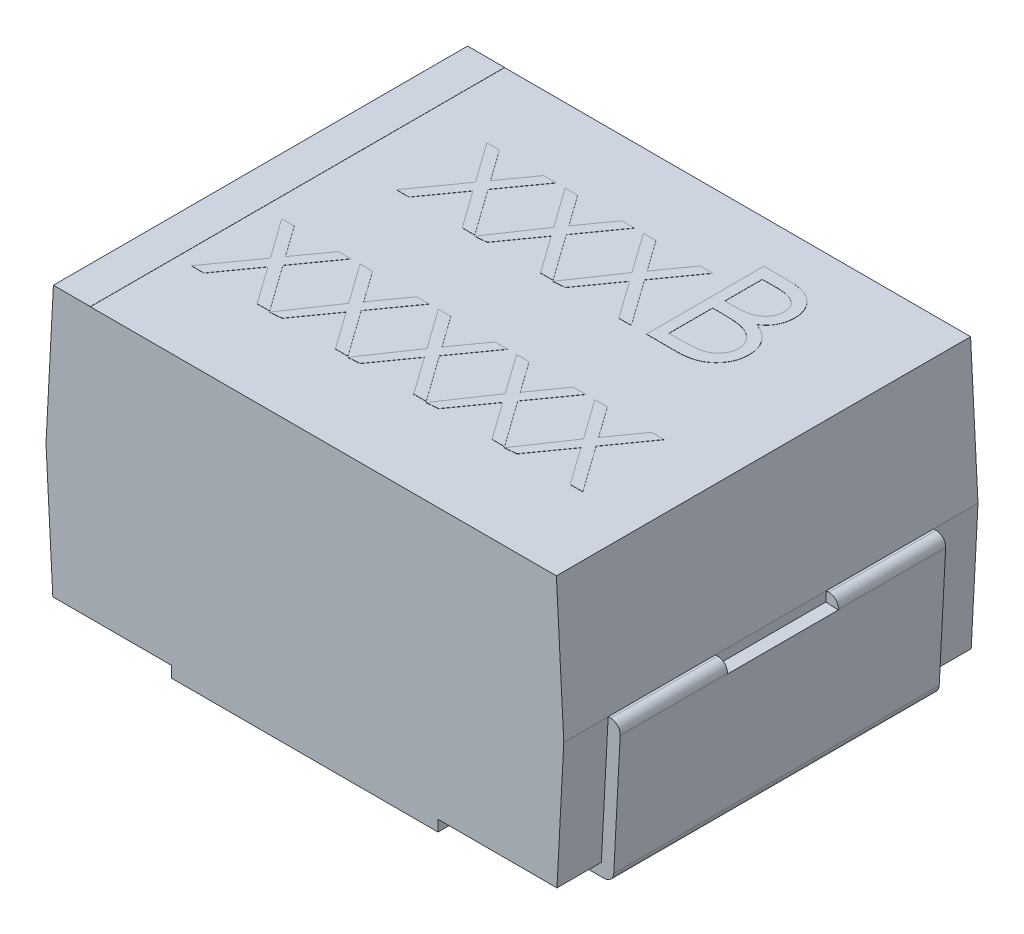
from build123d import *

# Parameters (mm, degrees)
BOSS_EXTRUDE1_DEPTH = 1.4
CUT_EXTRUDE1_REACH  = 5.436
BOSS_EXTRUDE2_DEPTH = 1.1
CUT_EXTRUDE2_REACH  = 5.98
SKETCH4_W           = 1.3
SKETCH4_H           = 1.2
SKETCH5_W           = 0.25
SKETCH5_H           = 2.8
BOSS_EXTRUDE3_DEPTH = 0.00125
BOSS_EXTRUDE4_DEPTH = 0.00125
BOSS_EXTRUDE5_DEPTH = 0.00125
CUT_EXTRUDE3_REACH  = 5.98
SKETCH8_W           = 0.75
SKETCH8_H           = 0.135


# Read off the part's stored shape, not the designer's step: Boss-Extrude4, Boss-Extrude5
with BuildPart() as part:
    # Sketch1 → Boss-Extrude1 (new, symmetric)
    with BuildSketch(Plane.XY):
        Polygon((-1.7, 0.95), (1.7, 0.95), (1.75, 0), (1.7, -0.95), (-1.7, -0.95), (-1.75, 0), align=None)
    extrude(amount=BOSS_EXTRUDE1_DEPTH, both=True)

    # Sketch2 → Cut-Extrude1 (cut, up to next)
    with BuildSketch(Plane.XY.offset(1.4), mode=Mode.PRIVATE) as cut_extrude1_sk1:
        Polygon((-1.7, -0.95), (-0.9, -0.95), (-0.9, -0.875), (-1.703947368, -0.875), align=None)
    cut_extrude1_tool1 = extrude(cut_extrude1_sk1.sketch, amount=-CUT_EXTRUDE1_REACH, mode=Mode.PRIVATE) & part.part
    # Sketch2 → Cut-Extrude1 (cut, up to next)
    with BuildSketch(Plane.XY.offset(1.4), mode=Mode.PRIVATE) as cut_extrude1_sk2:
        Polygon((1.7, -0.95), (0.9, -0.95), (0.9, -0.875), (1.703947368, -0.875), align=None)
    cut_extrude1_tool2 = extrude(cut_extrude1_sk2.sketch, amount=-CUT_EXTRUDE1_REACH, mode=Mode.PRIVATE) & part.part
    add(cut_extrude1_tool1.solids().sort_by_distance((-1.300988, -0.912469, 1.4))[0], mode=Mode.SUBTRACT)
    add(cut_extrude1_tool2.solids().sort_by_distance((1.300988, -0.912469, 1.4))[0], mode=Mode.SUBTRACT)

    # Sketch5 → Boss-Extrude3 (add)
    with BuildSketch(Plane(origin=(0, 0.95, 0), x_dir=(1, 0, 0), z_dir=(0, 1, 0))):
        with Locations((-1.575, 0)):
            Rectangle(SKETCH5_W, SKETCH5_H)
    extrude(amount=BOSS_EXTRUDE3_DEPTH)


with BuildPart() as body_2:
    # Sketch3 → Boss-Extrude2 (new, symmetric)
    with BuildSketch(Plane.XY):
        with BuildLine():
            Line((-1.75, 0), (-1.703947368, -0.875))
            Line((-1.703947368, -0.875), (-0.94, -0.875))
            Line((-0.94, -0.875), (-0.94, -0.895))
            ThreePointArc((-0.94, -0.895), (-0.959038059, -0.940961941), (-1.005, -0.96))
            Line((-1.005, -0.96), (-1.722804771, -0.96))
            ThreePointArc((-1.722804771, -0.96), (-1.767542557, -0.942154327), (-1.78771493, -0.898416324))
            Line((-1.78771493, -0.898416324), (-1.831399141, -0.068416324))
            ThreePointArc((-1.831399141, -0.068416324), (-1.813643309, -0.020262214), (-1.766488982, 0))
            Line((-1.766488982, 0), (-1.75, 0))
        make_face()
    extrude(amount=BOSS_EXTRUDE2_DEPTH, both=True)


with BuildPart() as body_3:
    # Mirror1: mirrored copy
    add(body_2.part.mirror(Plane(origin=(0, 0, 0), x_dir=(0, 0, 1), z_dir=(1, 0, 0))))

    # Cut-Extrude3: up to this face of the body (flat: up to its plane)
    cut_extrude3_end = Plane(body_3.part.faces().sort_by_distance((1.809557036, -0.483416324, 0))[0])
    # Sketch8 → Cut-Extrude3 (cut, up to the picked face)
    with BuildSketch(Plane(origin=(1.745165746, -0.091850829, 0), x_dir=(0, 0, -1), z_dir=(0.9986178293325098, -0.052558833122763125, 0)), mode=Mode.PRIVATE) as cut_extrude3_sk1:
        with Locations((0, 0.091977958)):
            Rectangle(SKETCH8_W, SKETCH8_H)
    cut_extrude3_tool1 = split(extrude(cut_extrude3_sk1.sketch, amount=CUT_EXTRUDE3_REACH, mode=Mode.PRIVATE), bisect_by=cut_extrude3_end, keep=Keep.BOTH, mode=Mode.PRIVATE)
    add(cut_extrude3_tool1.solids().sort_by(Axis((1.75, 0, 0), (0.9986178293325098, -0.052558833122763125, 0)))[0], mode=Mode.SUBTRACT)


with BuildPart() as body_2_1:
    add(body_2.part)

    # Cut-Extrude2: up to this face of the body (flat: up to its plane)
    cut_extrude2_end = Plane(body_2_1.part.faces().sort_by_distance((-1.809557036, -0.483416324, 0))[0])
    # Sketch4 → Cut-Extrude2 (cut, up to the picked face)
    with BuildSketch(Plane(origin=(-1.745165746, -0.091850829, 0), x_dir=(0, 0, 1), z_dir=(-0.9986178293325095, -0.052558833122767205, 0)), mode=Mode.PRIVATE) as cut_extrude2_sk1:
        with Locations((0, 0.091977958)):
            Rectangle(SKETCH4_W, SKETCH4_H)
    cut_extrude2_tool1 = split(extrude(cut_extrude2_sk1.sketch, amount=CUT_EXTRUDE2_REACH, mode=Mode.PRIVATE), bisect_by=cut_extrude2_end, keep=Keep.BOTH, mode=Mode.PRIVATE)
    add(cut_extrude2_tool1.solids().sort_by(Axis((-1.75, 0, 0), (-0.9986178293325095, -0.052558833122767205, 0)))[0], mode=Mode.SUBTRACT)


with BuildPart() as body_4:
    # Boss-Extrude4 outline → Boss-Extrude4 (new body)
    # profile 1 of 4: a face of its own
    with BuildSketch(Plane(origin=(0, 0.95, 0), x_dir=(1, 0, 0), z_dir=(0, 1, 0))):
        with BuildLine():
            add(Edge.make_bspline(
                [(1.058270111, 0.543776871), (1.058048576, 0.536028312), (1.0576127, 0.520782806), (1.054396885, 0.498386552), (1.048951963, 0.476983663), (1.041451899, 0.456435702), (1.031663303, 0.436782421), (1.019750711, 0.418001556), (1.005546767, 0.400281806), (0.989657509, 0.38342627), (0.971681987, 0.368270682), (0.952288236, 0.35477337), (0.931232017, 0.343673103), (0.908859154, 0.334348576), (0.884918675, 0.327225873), (0.859518084, 0.322242807), (0.832679287, 0.318885236), (0.814262075, 0.318609191), (0.804817086, 0.318467626)],
                knots=[0, 0, 0, 0, 0.061160277, 0.120334558, 0.178180255, 0.235235126, 0.292682961, 0.351186248, 0.41045661, 0.471719854, 0.533761203, 0.595739024, 0.657887515, 0.72129518, 0.786822515, 0.854686154, 0.925477986, 1, 1, 1, 1], degree=3))
            add(Edge.make_bspline(
                [(0.905466876, 0.746666494), (0.914483973, 0.74320461), (0.931735913, 0.736581169), (0.955477205, 0.724870984), (0.975932107, 0.712134219), (0.993257889, 0.698225032), (1.008075536, 0.683232498), (1.021014328, 0.666936785), (1.032054568, 0.649125316), (1.041514463, 0.6299838), (1.048896056, 0.60970769), (1.054424163, 0.588487175), (1.057591781, 0.566398347), (1.058042549, 0.55136577), (1.058270111, 0.543776871)],
                knots=[0, 0, 0, 0, 0.106057493, 0.202914257, 0.290300165, 0.370222566, 0.446383721, 0.5213969, 0.598291083, 0.676142469, 0.7555287, 0.834887172, 0.916646049, 1, 1, 1, 1], degree=3))
            add(Edge.make_bspline(
                [(0.997212419, 0.915529174), (0.996964492, 0.906763327), (0.996477294, 0.88953761), (0.991818489, 0.864343053), (0.984524909, 0.840360187), (0.974386397, 0.817676539), (0.961209695, 0.79680463), (0.945593612, 0.77757609), (0.92675298, 0.760805046), (0.912637102, 0.751429067), (0.905466876, 0.746666494)],
                knots=[0, 0, 0, 0, 0.130569107, 0.256580609, 0.380551617, 0.503622917, 0.625739323, 0.747548582, 0.871766119, 1, 1, 1, 1], degree=3))
            add(Edge.make_bspline(
                [(0.745031429, 1.112217626), (0.75261253, 1.112177768), (0.767306591, 1.112100514), (0.788674215, 1.110902375), (0.808687784, 1.109268686), (0.827353104, 1.106676504), (0.844661549, 1.103548726), (0.860665281, 1.099760993), (0.87531341, 1.095219243), (0.892801477, 1.087996961), (0.912740627, 1.077264743), (0.934330262, 1.061405943), (0.952791581, 1.042008402), (0.968708835, 1.020127514), (0.981363731, 0.996057438), (0.990518911, 0.970371872), (0.996315072, 0.943402119), (0.996911164, 0.924886613), (0.997212419, 0.915529174)],
                knots=[0, 0, 0, 0, 0.062594097, 0.121322939, 0.176680142, 0.228365096, 0.276868446, 0.321879128, 0.364098625, 0.403355696, 0.477967948, 0.550535461, 0.623584457, 0.698174882, 0.77335367, 0.847281125, 0.92281834, 1, 1, 1, 1], degree=3))
            Line((0.745031429, 1.112217626), (0.590161137, 1.112217626))
            Line((0.590161137, 1.112217626), (0.590161137, 0.318467626))
            Line((0.590161137, 0.318467626), (0.804817086, 0.318467626))
        make_face()
        with BuildLine():
            add(Edge.make_bspline(
                [(0.762839923, 0.399877882), (0.770101358, 0.399964911), (0.784096816, 0.400132646), (0.804303702, 0.400680233), (0.823032371, 0.401925803), (0.840197359, 0.403886558), (0.855984015, 0.406013456), (0.870202958, 0.408873514), (0.88296945, 0.412150332), (0.897772731, 0.417215403), (0.914442276, 0.425084067), (0.932406167, 0.436948187), (0.948377827, 0.451082222), (0.961940806, 0.467440483), (0.973056251, 0.485227588), (0.981142399, 0.504083765), (0.986129611, 0.523697447), (0.986733353, 0.537070256), (0.987036137, 0.543776871)],
                knots=[0, 0, 0, 0, 0.072502489, 0.139738989, 0.201795135, 0.259821934, 0.312205989, 0.360773434, 0.404540343, 0.443698099, 0.516840794, 0.587874336, 0.657965418, 0.728969389, 0.79930772, 0.866635778, 0.933116329, 1, 1, 1, 1], degree=3))
            Line((0.762839923, 0.399877882), (0.661395111, 0.399877882))
            Line((0.661395111, 0.399877882), (0.661395111, 0.694990062))
            Line((0.661395111, 0.694990062), (0.70861942, 0.694990062))
            add(Edge.make_bspline(
                [(0.857129536, 0.685608802), (0.85326758, 0.686392365), (0.844894064, 0.688091293), (0.831239845, 0.689884647), (0.815651532, 0.691482366), (0.798093129, 0.692664182), (0.778542422, 0.693885773), (0.756957657, 0.694360849), (0.73342698, 0.694927645), (0.717100139, 0.694968724), (0.70861942, 0.694990062)],
                knots=[0, 0, 0, 0, 0.079306486, 0.171952819, 0.277056507, 0.394730576, 0.526177321, 0.671344767, 0.829285257, 1, 1, 1, 1], degree=3))
            add(Edge.make_bspline(
                [(0.987036137, 0.543776871), (0.98697352, 0.547970896), (0.986849297, 0.556291297), (0.984975908, 0.568518634), (0.982251334, 0.580362716), (0.978729026, 0.591855704), (0.973599254, 0.602789809), (0.967610627, 0.613381282), (0.960589023, 0.623644125), (0.949647936, 0.636619047), (0.933733932, 0.651568084), (0.91112186, 0.666204267), (0.885410642, 0.678007966), (0.866762622, 0.683019812), (0.857129536, 0.685608802)],
                knots=[0, 0, 0, 0, 0.060287398, 0.119602355, 0.177503371, 0.235142664, 0.292132593, 0.350871209, 0.410097863, 0.470731522, 0.594828704, 0.722578824, 0.85669139, 1, 1, 1, 1], degree=3))
        make_face(mode=Mode.SUBTRACT)
        with BuildLine():
            add(Edge.make_bspline(
                [(0.709255438, 0.776400318), (0.716251504, 0.776491015), (0.729769329, 0.77666626), (0.749345448, 0.777168254), (0.767516658, 0.778573881), (0.784251591, 0.779979105), (0.799523896, 0.782263878), (0.813299736, 0.78498352), (0.82579531, 0.787859821), (0.840205172, 0.792751473), (0.856550287, 0.799980874), (0.873974937, 0.81120038), (0.889336147, 0.824563582), (0.902307652, 0.83998296), (0.912923825, 0.856961542), (0.920297471, 0.875228424), (0.92529748, 0.894328346), (0.925749131, 0.9074407), (0.925978444, 0.914098135)],
                knots=[0, 0, 0, 0, 0.072301034, 0.139700332, 0.202288511, 0.260599533, 0.313190329, 0.361738933, 0.405706476, 0.445539985, 0.518831956, 0.58977824, 0.658867479, 0.728430478, 0.797282704, 0.864815377, 0.931363753, 1, 1, 1, 1], degree=3))
            Line((0.709255438, 0.776400318), (0.661395111, 0.776400318))
            Line((0.661395111, 0.776400318), (0.661395111, 1.030807369))
            Line((0.661395111, 1.030807369), (0.75806979, 1.030807369))
            add(Edge.make_bspline(
                [(0.925978444, 0.914098135), (0.925859114, 0.918503622), (0.925625035, 0.927145467), (0.923707947, 0.939743267), (0.920449586, 0.951591403), (0.916264416, 0.962852246), (0.91041591, 0.973173684), (0.90352991, 0.982912587), (0.89521012, 0.9917373), (0.885740158, 0.999985382), (0.874852488, 1.007297981), (0.862553606, 1.013702582), (0.848677115, 1.018859866), (0.833456878, 1.023376564), (0.816658613, 1.02654891), (0.79847617, 1.029191731), (0.778760618, 1.030537193), (0.765120568, 1.030715302), (0.75806979, 1.030807369)],
                knots=[0, 0, 0, 0, 0.057003133, 0.111817869, 0.164402372, 0.215869805, 0.26684111, 0.317478963, 0.369902136, 0.423400449, 0.479718398, 0.539241497, 0.602430689, 0.671029546, 0.744484798, 0.823453971, 0.908740313, 1, 1, 1, 1], degree=3))
        make_face(mode=Mode.SUBTRACT)
    # profile 2 of 4: a face of its own
    with BuildSketch(Plane(origin=(0, 0.95, 0), x_dir=(1, 0, 0), z_dir=(0, 1, 0))):
        Polygon((0.223814983, 0.570489611), (0.403648967, 0.318467626), (0.488398316, 0.318467626), (0.266269159, 0.629957259), (0.45786947, 0.898515703), (0.373120121, 0.898515703), (0.223814983, 0.689265903), (0.074509845, 0.898515703), (-0.010239504, 0.898515703), (0.181519811, 0.629957259), (-0.034962261, 0.3103258), (0.043980998, 0.318467626), align=None)
    # profile 3 of 4: a face of its own
    with BuildSketch(Plane(origin=(0, 0.95, 0), x_dir=(1, 0, 0), z_dir=(0, 1, 0))):
        Polygon((-0.305351684, 0.570489611), (-0.1255177, 0.318467626), (-0.040768351, 0.318467626), (-0.262897507, 0.629957259), (-0.071297197, 0.898515703), (-0.156046546, 0.898515703), (-0.305351684, 0.689265903), (-0.454656822, 0.898515703), (-0.539406171, 0.898515703), (-0.347646856, 0.629957259), (-0.564128927, 0.3103258), (-0.485185668, 0.318467626), align=None)
    # profile 4 of 4: a face of its own
    with BuildSketch(Plane(origin=(0, 0.95, 0), x_dir=(1, 0, 0), z_dir=(0, 1, 0))):
        Polygon((-0.876813523, 0.629957259), (-1.099101684, 0.318467626), (-1.014352335, 0.318467626), (-0.834518351, 0.570489611), (-0.654684366, 0.318467626), (-0.569935017, 0.318467626), (-0.792064174, 0.629957259), (-0.600463863, 0.898515703), (-0.685213212, 0.898515703), (-0.834518351, 0.689265903), (-0.983823489, 0.898515703), (-1.068572838, 0.898515703), align=None)
    extrude(amount=BOSS_EXTRUDE4_DEPTH)


with BuildPart() as body_5:
    # Boss-Extrude5 outline → Boss-Extrude5 (new body)
    with BuildSketch(Plane(origin=(0, 0.95, 0), x_dir=(1, 0, 0), z_dir=(0, 1, 0))):
        Polygon((0.88428308, -0.239423497), (0.799533731, -0.239423497), (0.991293046, -0.50798194), (0.774810975, -0.827613399), (0.853754234, -0.819471574), (1.033588218, -0.567449588), (1.213422202, -0.819471574), (1.298171551, -0.819471574), (1.076042395, -0.50798194), (1.267642705, -0.239423497), (1.182893356, -0.239423497), (1.033588218, -0.448673296), align=None)
        Polygon((0.504421551, -0.567449588), (0.684255536, -0.819471574), (0.769004885, -0.819471574), (0.546875728, -0.50798194), (0.738476038, -0.239423497), (0.65372669, -0.239423497), (0.504421551, -0.448673296), (0.355116413, -0.239423497), (0.270367064, -0.239423497), (0.462126379, -0.50798194), (0.245644308, -0.827613399), (0.324587567, -0.819471574), align=None)
        Polygon((-0.024745115, -0.567449588), (0.155088869, -0.819471574), (0.239838218, -0.819471574), (0.017709061, -0.50798194), (0.209309372, -0.239423497), (0.124560023, -0.239423497), (-0.024745115, -0.448673296), (-0.174050254, -0.239423497), (-0.258799603, -0.239423497), (-0.067040288, -0.50798194), (-0.283522359, -0.827613399), (-0.2045791, -0.819471574), align=None)
        Polygon((-0.553911782, -0.567449588), (-0.374077798, -0.819471574), (-0.289328449, -0.819471574), (-0.511457605, -0.50798194), (-0.319857295, -0.239423497), (-0.404606644, -0.239423497), (-0.553911782, -0.448673296), (-0.70321692, -0.239423497), (-0.787966269, -0.239423497), (-0.596206954, -0.50798194), (-0.812689025, -0.827613399), (-0.733745766, -0.819471574), align=None)
        Polygon((-1.125373621, -0.50798194), (-1.347661782, -0.819471574), (-1.262912433, -0.819471574), (-1.083078449, -0.567449588), (-0.903244464, -0.819471574), (-0.818495115, -0.819471574), (-1.040624272, -0.50798194), (-0.849023962, -0.239423497), (-0.93377331, -0.239423497), (-1.083078449, -0.448673296), (-1.232383587, -0.239423497), (-1.317132936, -0.239423497), align=None)
    extrude(amount=BOSS_EXTRUDE5_DEPTH)


solid = Compound([part.part, body_3.part, body_2_1.part, body_4.part, body_5.part])
